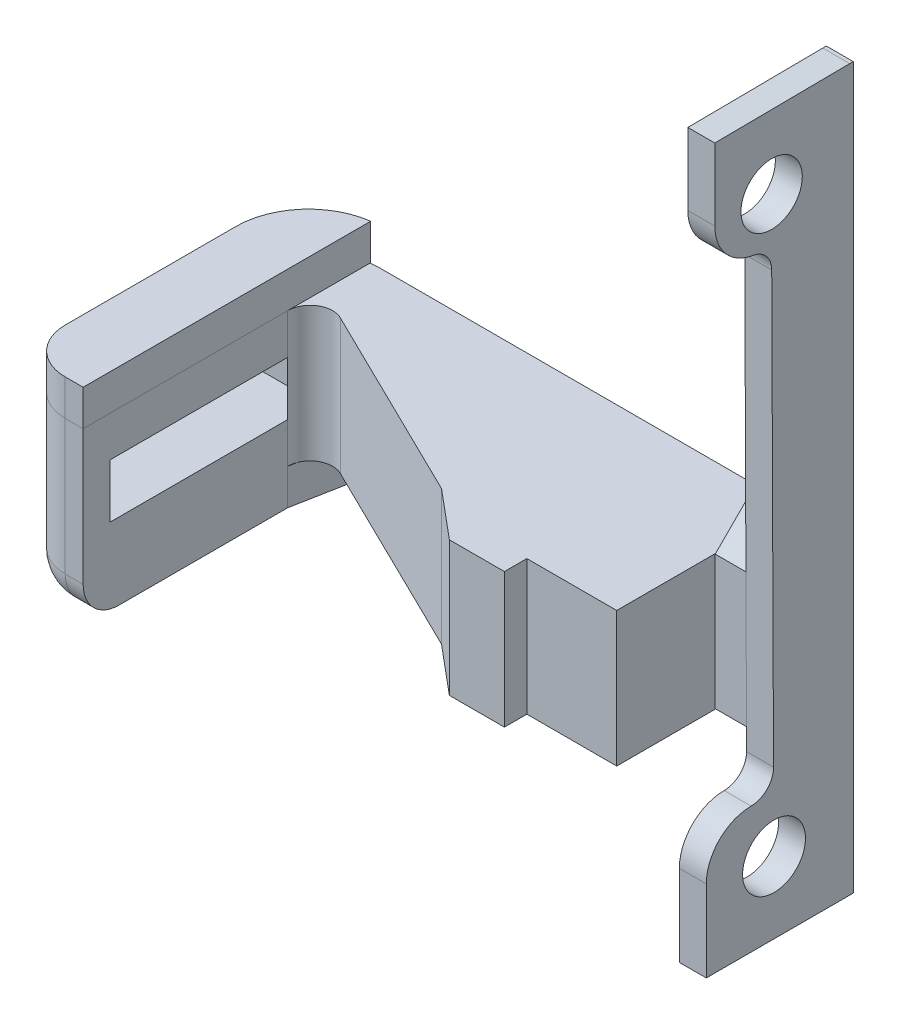
from build123d import *

# Parameters (mm, degrees)
BOSS_EXTRUDE5_DEPTH  = 3
SKETCH13_W           = 4.6
SKETCH13_H           = 1.2
CUT_EXTRUDE5_DEPTH   = 1.398785094
SKETCH14_W           = 1.772405836
SKETCH14_H           = 3
BOSS_EXTRUDE6_DEPTH  = 0.7
BOSS_EXTRUDE7_START  = 0.8
BOSS_EXTRUDE7_DEPTH  = 0.8
BOSS_EXTRUDE8_DEPTH  = 0.8
SKETCH17_W           = 0.7
SKETCH17_H           = 1.772405836
BOSS_EXTRUDE9_DEPTH  = 0.69
SKETCH18_W           = 0.7
SKETCH18_H           = 1.772405836
BOSS_EXTRUDE10_DEPTH = 0.69
CHAMFER1_SIZE        = 0.7
FILLET7_R            = 0.8
SKETCH19_R           = 0.699995293
SKETCH19_R_2         = 0.683077483
BOSS_EXTRUDE11_DEPTH = 0.6
FILLET9_R            = 0.5
FILLET10_R           = 1


with BuildPart() as part:
    # Sketch12 → Boss-Extrude5 (new body)
    with BuildSketch(Plane(origin=(0, 0, 0), x_dir=(1, 0, 0), z_dir=(0, 1, 0))):
        with BuildLine():
            Line((0.7, -5.4), (1.098785094, -5.4))
            Line((1.098785094, -5.4), (1.098785094, -0.847061546))
            ThreePointArc((1.098785094, -0.847061546), (1.341799578, -0.418157775), (1.834618872, -0.406173319))
            Line((1.834618872, -0.406173319), (6.24, -2.564530465))
            Line((6.24, -2.564530465), (7.314759908, -3.464530465))
            Line((7.314759908, -3.464530465), (8.54, -3.464530465))
            Line((8.54, -3.464530465), (8.54, -2.964530465))
            Line((8.54, -2.964530465), (10.54, -2.964530465))
            Line((10.54, -2.964530465), (10.54, 1.000327451))
            Line((10.54, 1.000327451), (1.6, 1.000327451))
            Line((1.6, 1.000327451), (1.3, 1.000327451))
            ThreePointArc((1.3, 1.000327451), (0.16862915, 0.531698301), (-0.3, -0.599672549))
            Line((-0.3, -0.599672549), (-0.3, -4.4))
            ThreePointArc((-0.3, -4.4), (-0.007106781, -5.107106781), (0.7, -5.4))
        make_face()
    extrude(amount=BOSS_EXTRUDE5_DEPTH)

    # Sketch13 → Cut-Extrude5 (cut)
    with BuildSketch(Plane.ZY.offset(0.3)):
        with Locations((2.5, 1.5)):
            Rectangle(SKETCH13_W, SKETCH13_H)
    extrude(amount=-CUT_EXTRUDE5_DEPTH, mode=Mode.SUBTRACT)

    # Sketch14 → Boss-Extrude6 (add)
    with BuildSketch(Plane(origin=(10.54, 0, 0), x_dir=(0, 0, -1), z_dir=(1, 0, 0))):
        with Locations((0.114124533, 1.5)):
            Rectangle(SKETCH14_W, SKETCH14_H)
    extrude(amount=BOSS_EXTRUDE6_DEPTH)

    # Sketch15 → Boss-Extrude7 (add)
    with BuildSketch(Plane.XZ.offset(BOSS_EXTRUDE7_START)):
        with BuildLine():
            Line((-0.3, 0.599672549), (-0.3, 4.4))
            ThreePointArc((-0.3, 4.4), (-0.007106781, 5.107106781), (0.7, 5.4))
            Line((0.7, 5.4), (1.098785094, 5.4))
            Line((1.098785094, 5.4), (1.098785094, 0.847061546))
            Line((1.098785094, 0.847061546), (1.45, -1.000327451))
            Line((1.45, -1.000327451), (1.3, -1.000327451))
            ThreePointArc((1.3, -1.000327451), (0.16862915, -0.531698301), (-0.3, 0.599672549))
        make_face()
    extrude(amount=-BOSS_EXTRUDE7_DEPTH)

    # Sketch17 → Boss-Extrude9 (add)
    with BuildSketch(Plane(origin=(0, 3, 0), x_dir=(1, 0, 0), z_dir=(0, 1, 0))):
        with Locations((10.89, 0.114124533)):
            Rectangle(SKETCH17_W, SKETCH17_H)
    extrude(amount=BOSS_EXTRUDE9_DEPTH)

    # Sketch18 → Boss-Extrude10 (add)
    with BuildSketch(Plane.XZ):
        with Locations((10.89, -0.114124533)):
            Rectangle(SKETCH18_W, SKETCH18_H)
    extrude(amount=BOSS_EXTRUDE10_DEPTH)

    # Chamfer1
    # the kernel refuses this chamfer: 0.7 mm, written as the material it takes off along each edge
    with BuildSketch(Plane(origin=(13.040178092, 3.69, 0.772078385), x_dir=(0, -0.9996219169112968, 0.027495876610586445), z_dir=(-1, 0, 0))) as chamfer1_piece_1:
        Polygon((CHAMFER1_SIZE * 0.999621916911, -CHAMFER1_SIZE * 0.0274958766106), (-CHAMFER1_SIZE * 0.0274958766106, -CHAMFER1_SIZE * 0.999621916911), (0, 0), align=None)
    extrude(amount=2.500178092, mode=Mode.SUBTRACT)
    with BuildSketch(Plane(origin=(13.040178092, -0.69, 0.772078385), x_dir=(0, 0.9996219169112968, 0.027495876610586438), z_dir=(-1, 0, 0))) as chamfer1_piece_2:
        Polygon((CHAMFER1_SIZE * 0.999621916911, CHAMFER1_SIZE * 0.0274958766106), (-CHAMFER1_SIZE * 0.0274958766106, CHAMFER1_SIZE * 0.999621916911), (0, 0), align=None)
    extrude(amount=2.500178092, mode=Mode.SUBTRACT)

    # Fillet7
    # the kernel refuses this fillet: 0.8 mm, written as the material it takes off along each edge
    with BuildSketch(Plane(origin=(0.7, -0.8, 5.4), x_dir=(0, 0, -1), z_dir=(1, 0, 0))) as fillet7_piece_1:
        with BuildLine():
            CenterArc((FILLET7_R, FILLET7_R), FILLET7_R, 180, 90)
            Line((0, FILLET7_R), (0, 0))
            Line((0, 0), (FILLET7_R, 0))
        make_face()
    extrude(amount=2.398785094, mode=Mode.SUBTRACT)
    with BuildSketch(Plane(origin=(3.45, -0.8, -1.000327451), x_dir=(0, 0, 1), z_dir=(-1, 0, 0))) as fillet7_piece_2:
        with BuildLine():
            CenterArc((FILLET7_R, FILLET7_R), FILLET7_R, 180, 90)
            Line((0, FILLET7_R), (0, 0))
            Line((0, 0), (FILLET7_R, 0))
        make_face()
    extrude(amount=2.15, mode=Mode.SUBTRACT)
    with BuildSketch(Plane(origin=(1.3, -0.8, 0.599672549), x_dir=(0, 0, -1), z_dir=(1, 0, 0))) as fillet7_piece_3:
        with BuildLine():
            CenterArc((1.6 - FILLET7_R, FILLET7_R), FILLET7_R, 270, 90)
            Line((1.6, FILLET7_R), (1.6, 0))
            Line((1.6, 0), (1.6 - FILLET7_R, 0))
        make_face()
    revolve(axis=Axis((1.3, -0.8, 0.599672549), (0, 1, 0)), revolution_arc=90, mode=Mode.SUBTRACT)
    with BuildSketch(Plane(origin=(-0.3, -0.8, 0.599672549), x_dir=(1, 0, 0), z_dir=(0, 0, 1))) as fillet7_piece_4:
        with BuildLine():
            CenterArc((FILLET7_R, FILLET7_R), FILLET7_R, 180, 90)
            Line((0, FILLET7_R), (0, 0))
            Line((0, 0), (FILLET7_R, 0))
        make_face()
    extrude(amount=3.800327451, mode=Mode.SUBTRACT)
    with BuildSketch(Plane(origin=(0.7, -0.8, 4.4), x_dir=(-1, 0, 0), z_dir=(0, 0, -1))) as fillet7_piece_5:
        with BuildLine():
            CenterArc((1 - FILLET7_R, FILLET7_R), FILLET7_R, 270, 90)
            Line((1, FILLET7_R), (1, 0))
            Line((1, 0), (1 - FILLET7_R, 0))
        make_face()
    revolve(axis=Axis((0.7, -0.8, 4.4), (0, 1, 0)), revolution_arc=90, mode=Mode.SUBTRACT)


with BuildPart() as body_2:
    # Sketch16 → Boss-Extrude8 (new body)
    with BuildSketch(Plane(origin=(0, 3, 0), x_dir=(1, 0, 0), z_dir=(0, 1, 0))):
        with BuildLine():
            Line((1.098785094, -5.4), (1.098785094, -0.847061546))
            Line((1.098785094, -0.847061546), (1.098785094, 1.000327451))
            ThreePointArc((1.098785094, 1.000327451), (0.09900082, 0.46294212), (-0.3, -0.599672549))
            Line((-0.3, -0.599672549), (-0.3, -4.4))
            ThreePointArc((-0.3, -4.4), (-0.007106781, -5.107106781), (0.7, -5.4))
            Line((0.7, -5.4), (1.098785094, -5.4))
        make_face()
    extrude(amount=BOSS_EXTRUDE8_DEPTH)


with BuildPart() as body_3:
    # Sketch19 → Boss-Extrude11 (new body)
    # profile 1 of 2: a face of its own
    with BuildSketch(Plane(origin=(11.24, 0, 0), x_dir=(0, 0, -1), z_dir=(1, 0, 0))):
        Polygon((1.000327451, 12.248278955), (0.920966212, 12.248278955), (-2.080817644, 12.219038508), (-2.080817644, 9.635603478), (-0.816557514, 9.635603478), (-0.772078385, -0.967307084), (-2.271016584, -0.967307084), (-2.271016584, -3.781900205), (1.000327451, -3.781900205), (1.000327451, -0.69), (-0.072078385, -0.69), (-0.772078385, 0.01), (-0.772078385, 2.99), (-0.072078385, 3.69), (1.000327451, 3.69), align=None)
        with Locations((-0.762895052, -2.189022372)):
            Circle(SKETCH19_R, mode=Mode.SUBTRACT)
        with Locations((-0.816557514, 10.602447151)):
            Circle(SKETCH19_R_2, mode=Mode.SUBTRACT)
    # profile 2 of 2: a face of its own
    with BuildSketch(Plane(origin=(11.24, 0, 0), x_dir=(0, 0, -1), z_dir=(1, 0, 0))):
        Polygon((1.000327451, -0.69), (1.000327451, 3.69), (-0.072078385, 3.69), (-0.772078385, 2.99), (-0.772078385, 0.01), (-0.072078385, -0.69), align=None)
    extrude(amount=BOSS_EXTRUDE11_DEPTH)

    # Fillet9
    fillet9_edges = [body_3.edges().sort_by_distance(p)[0] for p in [
        (11.54, -0.967307084, 0.772078385),
        (11.54, 9.635603478, 0.816557514),
    ]]
    fillet(fillet9_edges, radius=FILLET9_R)

    # Fillet10
    fillet10_edges = [body_3.edges().sort_by_distance(p)[0] for p in [
        (11.54, -0.967307084, 2.271016584),
        (11.54, 9.635603478, 2.080817644),
    ]]
    fillet(fillet10_edges, radius=FILLET10_R)


solid = Compound([part.part, body_2.part, body_3.part])
